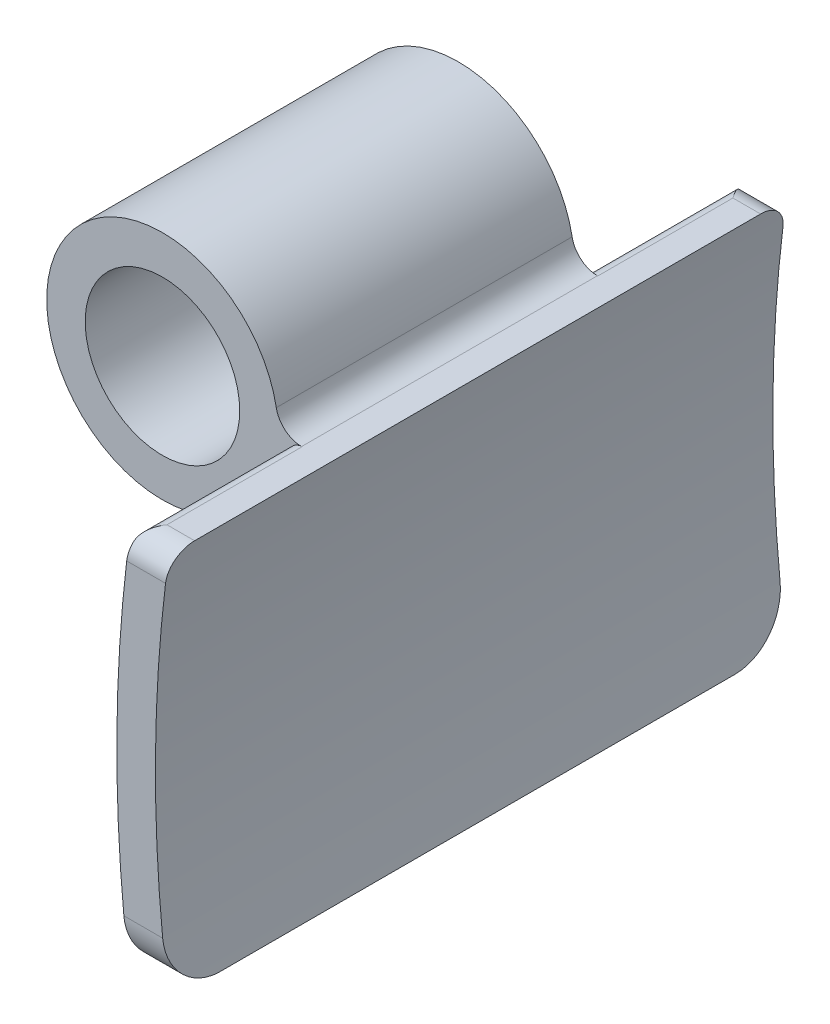
from build123d import *

# Parameters (mm, degrees)
BOSS_EXTRUDE1_DEPTH = 18.25625
SKETCH2_R           = 9.5377
CUT_EXTRUDE1_DEPTH  = 59.232550302
BOSS_EXTRUDE2_START = 19.84375
BOSS_EXTRUDE2_DEPTH = 19.84375
BOSS_EXTRUDE3_DEPTH = 19.84375
FILLET2_R           = 6.35
FILLET3_R           = 3.175
FILLET5_R           = 1.5875
FILLET6_R           = 3.175


with BuildPart() as part:
    # Sketch1 → Boss-Extrude1 (new, symmetric)
    with BuildSketch(Plane.XY):
        with BuildLine():
            Line((1.403672164, 19.691144131), (4.869734215, 19.691144131))
            ThreePointArc((4.869734215, 19.691144131), (3.208035766, -4.121355869), (4.869734215, -27.933855869))
            Line((4.869734215, -27.933855869), (0.061901788, -27.933855869))
            ThreePointArc((0.061901788, -27.933855869), (-1.356220949, -12.477586426), (-1.408740732, 3.043514659))
            ThreePointArc((-1.408740732, 3.043514659), (-3.712015543, 7.317965291), (-8.567418141, 7.350655889))
            ThreePointArc((-8.567418141, 7.350655889), (-28.755262527, 25.645771293), (-1.718407463, 22.288871403))
            ThreePointArc((-1.718407463, 22.288871403), (-0.627064659, 20.425502216), (1.403672164, 19.691144131))
        make_face()
    extrude(amount=BOSS_EXTRUDE1_DEPTH, both=True)

    # Sketch2 → Cut-Extrude1 (cut, through all)
    with BuildSketch(Plane.XY.offset(18.25625)):
        with Locations((-15.767765785, 19.691144131)):
            Circle(SKETCH2_R)
    extrude(amount=-CUT_EXTRUDE1_DEPTH, mode=Mode.SUBTRACT)

    # Sketch4 → Boss-Extrude2 (add)
    with BuildSketch(Plane.XY.offset(18.25625).offset(BOSS_EXTRUDE2_START)):
        with BuildLine():
            ThreePointArc((-1.408740732, 3.043514659), (-1.356220949, -12.477586426), (0.061901788, -27.933855869))
            Line((0.061901788, -27.933855869), (4.869734215, -27.933855869))
            ThreePointArc((4.869734215, -27.933855869), (3.208035766, -4.121355869), (4.869734215, 19.691144131))
            Line((4.869734215, 19.691144131), (1.403672164, 19.691144131))
            ThreePointArc((1.403672164, 19.691144131), (0.737132208, 19.761897123), (0.100299146, 19.971002722))
            ThreePointArc((0.100299146, 19.971002722), (-0.858408657, 11.525461487), (-1.408740732, 3.043514659))
        make_face()
    extrude(amount=-BOSS_EXTRUDE2_DEPTH)

    # Sketch5 → Boss-Extrude3 (add)
    with BuildSketch(Plane(origin=(0, 0, -18.25625), x_dir=(-1, 0, 0), z_dir=(0, 0, -1))):
        with BuildLine():
            ThreePointArc((-4.869734215, 19.691144131), (-3.208035766, -4.121355869), (-4.869734215, -27.933855869))
            Line((-4.869734215, -27.933855869), (-0.061901788, -27.933855869))
            ThreePointArc((-0.061901788, -27.933855869), (1.356220949, -12.477586426), (1.408740732, 3.043514659))
            ThreePointArc((1.408740732, 3.043514659), (0.858408657, 11.525461487), (-0.100299146, 19.971002722))
            ThreePointArc((-0.100299146, 19.971002722), (-0.737132208, 19.761897123), (-1.403672164, 19.691144131))
            Line((-1.403672164, 19.691144131), (-4.869734215, 19.691144131))
        make_face()
    extrude(amount=BOSS_EXTRUDE3_DEPTH)

    # Fillet2
    fillet2_edges = [part.edges().sort_by_distance(p)[0] for p in [
        (2.465818001, -27.933855869, 38.1),
        (2.465818001, -27.933855869, -38.1),
    ]]
    fillet(fillet2_edges, radius=FILLET2_R)

    # Fillet3
    # the kernel refuses this fillet: 3.175 mm, written as the material it takes off along each edge
    with BuildSketch(Plane(origin=(0.061901788, -27.933855869, 38.798080837), x_dir=(1, 0, 0), z_dir=(0, 0, -1))) as fillet3_piece_1:
        with BuildLine():
            CenterArc((2.793718395, -3.175), FILLET3_R, 90, 83.150253564)
            ThreePointArc((-0.358619505, -2.796330275), (-0.18490217, -1.39744793), (0, 0))
            Line((0, 0), (2.793718395, 0))
        make_face()
    extrude(amount=77.596161674, mode=Mode.SUBTRACT)

    # Fillet5
    # the kernel refuses this fillet: 1.5875 mm, written as the material it takes off along each edge
    with BuildSketch(Plane(origin=(0.100299146, 19.971002722, 42.300034066), x_dir=(-0.13199952505411708, -0.9912497795134622, 0), z_dir=(0, 0, -1)), Plane(origin=(0.100299146, 19.971002722, -18.25625), x_dir=(-0.1319995250540647, -0.9912497795134693, 0), z_dir=(0, 0, -1))) as fillet5_piece_1:
        with BuildLine():
            CenterArc((1.672445997, -1.587481962), FILLET5_R, 89.726869391, 82.687978074)
            Line((0.098836972, -1.377932716), (-0.05852393, -1.356977792))
            ThreePointArc((-0.05852393, -1.356977792), (-0.051995755, -1.307954493), (-0.152092645, -0.045490546))
            Line((-0.152092645, -0.045490546), (-0.000756763, 0.158748196))
            ThreePointArc((-0.000756763, 0.158748196), (0.840006813, 0.160752172), (1.680770389, 0.158748196))
            Line((1.680770389, 0.158748196), (1.680013626, 0))
        make_face()
    extrude(amount=24.043784066, mode=Mode.SUBTRACT)

    # Fillet6
    # the kernel refuses this fillet: 3.175 mm, written as the material it takes off along each edge
    with BuildSketch(Plane(origin=(12.807234215, 19.691144131, 38.1), x_dir=(0, -1, 0), z_dir=(-1, 0, 0)), Plane(origin=(-6.484371786, 19.691144131, -38.1), x_dir=(0, -1, 0), z_dir=(1, 0, 0))) as fillet6_piece_1:
        with BuildLine():
            CenterArc((FILLET6_R, -FILLET6_R), FILLET6_R, 90, 90)
            Line((0, -FILLET6_R), (0, 0))
            Line((0, 0), (FILLET6_R, 0))
        make_face()
    extrude(amount=19.291606, mode=Mode.SUBTRACT)


solid = part.part
